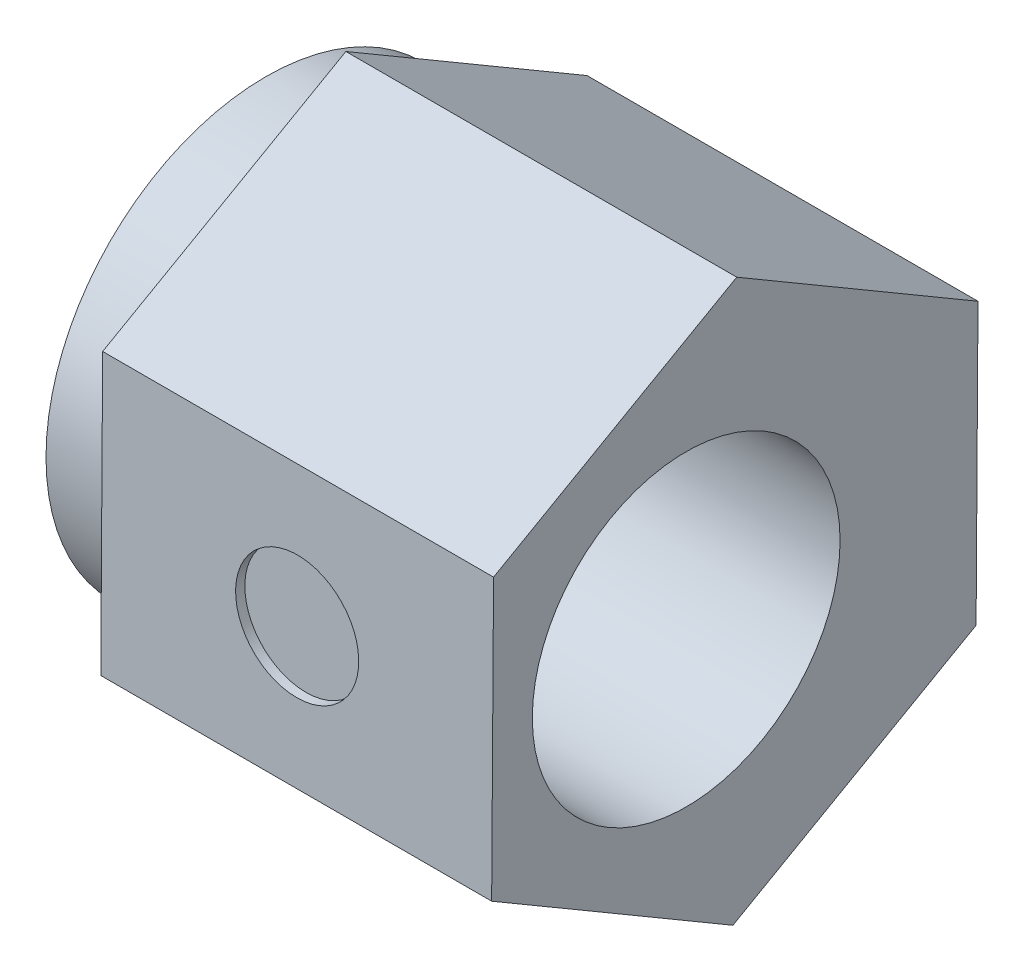
from build123d import *

# Parameters (mm, degrees)
BOSS_EXTRUDE1_DEPTH = 6.35
SKETCH4_R           = 3.57
BOSS_EXTRUDE2_DEPTH = 1.27
SKETCH3_R           = 2.5
CUT_EXTRUDE1_DEPTH  = 10.711569268
SKETCH5_R           = 1
CUT_EXTRUDE3_DEPTH  = 0.15


with BuildPart() as part:
    # Sketch2 → Boss-Extrude1 (new body)
    with BuildSketch(Plane(origin=(0, 0, 0), x_dir=(0, 0, -1), z_dir=(1, 0, 0))):
        Polygon((3.919437566, -2.29861752), (3.950379949, 2.245023741), (0.030942383, 4.54364126), (-3.919437566, 2.29861752), (-3.950379949, -2.245023741), (-0.030942383, -4.54364126), align=None)
    extrude(amount=BOSS_EXTRUDE1_DEPTH)

    # Sketch4 → Boss-Extrude2 (add)
    with BuildSketch(Plane.ZY):
        Circle(SKETCH4_R)
    extrude(amount=BOSS_EXTRUDE2_DEPTH)

    # Sketch3 → Cut-Extrude1 (cut, through all)
    with BuildSketch(Plane.ZY.offset(1.27)):
        with Locations((0.79, 0)):
            Circle(SKETCH3_R)
    extrude(amount=-CUT_EXTRUDE1_DEPTH, mode=Mode.SUBTRACT)

    # Sketch5 → Cut-Extrude3 (cut)
    with BuildSketch(Plane(origin=(0, 0.02679689, 3.934908757), x_dir=(1, 0, 0), z_dir=(0, -0.006809882993303443, -0.9999768124779782))):
        with Locations((3.175, 0)):
            Circle(SKETCH5_R)
    extrude(amount=CUT_EXTRUDE3_DEPTH, mode=Mode.SUBTRACT)


solid = part.part
